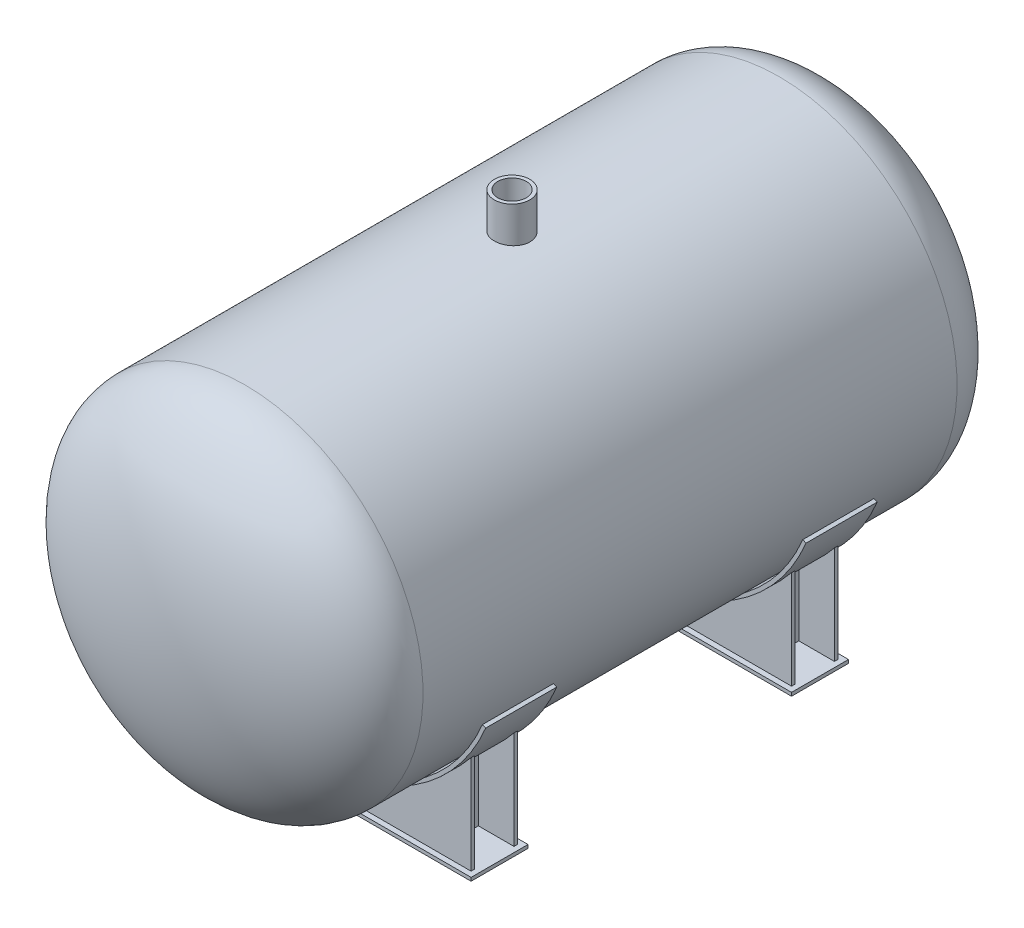
from build123d import *

# Parameters (mm, degrees)
REVOLVE_THIN1_OUTLINE_W   = 241.554
REVOLVE_THIN1_OUTLINE_H   = 38100
REVOLVE_THIN1_OUTLINE_H_2 = 6107.286275081
BOSS_EXTRUDE1_REACH       = 39840.343
BOSS_EXTRUDE1_END_RADIUS  = 12700
SKETCH2_R                 = 1270
SKETCH2_4_R               = 1016
CUT_EXTRUDE2_DEPTH        = 5334
EXTRUDE_THIN1_DEPTH       = 5080
BOSS_EXTRUDE2_DEPTH       = 241.554
BOSS_EXTRUDE3_DEPTH       = 241.554
SKETCH7_W                 = 2818.892
SKETCH7_H                 = 5080
BOSS_EXTRUDE4_DEPTH       = 241.554
SKETCH8_W                 = 2818.892
SKETCH8_H                 = 5080
BOSS_EXTRUDE5_DEPTH       = 241.554
SKETCH9_W                 = 21082
SKETCH9_H                 = 4064
BOSS_EXTRUDE6_DEPTH       = 241.554


# Read off the part's stored shape, not the designer's step: Revolve-Thin1
with BuildPart() as part:
    # Revolve-Thin1 outline → Revolve-Thin1 (revolve)
    with BuildSketch(Plane.XZ):
        with BuildLine():
            Line((12458.446, 19050), (12700, 19050))
            add(Edge.make_bspline(
                [(12700, 19050), (12700, 19672.212792945), (12458.446, 20282.591098568)],
                knots=[0, 0, 0, 0.209180689, 0.209180689, 0.209180689], degree=2, weights=[1, 0.960995831, 0.93237992]))
            Line((12458.446, 20282.591098568), (12458.446, 19050))
        make_face()
        with Locations((12579.223, 0)):
            Rectangle(REVOLVE_THIN1_OUTLINE_W, REVOLVE_THIN1_OUTLINE_H)
        with BuildLine():
            Line((12458.446, 19050), (12458.446, 20282.591098568))
            add(Edge.make_bspline(
                [(12458.446, 20282.591098568), (10950.298262556, 24093.501539344), (3477.674138965, 25157.286275081)],
                knots=[0.209180689, 0.209180689, 0.209180689, 1.277666813, 1.277666813, 1.277666813], degree=2, weights=[0.93237992, 0.786211057, 0.911084654]))
            Line((3477.674138965, 25157.286275081), (241.554, 25157.286275081))
            add(Edge.make_bspline(
                [(12458.446, 19050), (12458.446, 19128.360782016), (12455.30781716, 19206.148761458), (12443.010177021, 19360.625676184), (12433.850548794, 19437.31458027), (12409.727754911, 19589.633087136), (12394.764465027, 19665.262667241), (12359.219561467, 19815.496332604), (12338.63785601, 19890.100401109), (12303.668463951, 20001.258721755), (12291.328973355, 20038.186824626), (12275.061419578, 20084.193048318), (12271.765745268, 20093.386597076), (12265.090318364, 20111.758348049), (12261.709775455, 20120.938546931), (12251.462738317, 20148.402390778), (12244.484670145, 20166.626544561), (12208.877663579, 20257.331727468), (12178.101611862, 20328.567670849), (12112.3521677, 20468.60556913), (12077.37825829, 20537.407224248), (12003.551105812, 20672.760954559), (11964.697479581, 20739.312807561), (11883.378064491, 20870.321862974), (11840.911986397, 20934.778897662), (11752.593947216, 21061.729533345), (11706.741764435, 21124.223005782), (11647.430957785, 21201.182634036), (11635.468944632, 21216.516656789), (11617.378203209, 21239.432028849), (11611.323334963, 21247.056208713), (11599.164689255, 21262.276206563), (11593.059602946, 21269.873622091), (11562.448487739, 21307.74622806), (11537.661608642, 21337.708352381), (11462.448450122, 21426.633564336), (11411.170712082, 21484.636688989), (11306.536144088, 21598.298900389), (11253.179061975, 21653.957702844), (11144.546340289, 21763.112261769), (11089.27051472, 21816.607808544), (10976.93636394, 21921.589252253), (10919.877898914, 21973.074991556), (10804.094866676, 22074.168050718), (10745.370192594, 22123.775250087), (10626.355132409, 22221.224412617), (10566.064663398, 22269.066282304), (10444.005210705, 22363.083094686), (10382.236161848, 22409.257963899), (10257.295752829, 22500.026689561), (10194.12434082, 22544.620487557), (10098.365700913, 22610.382035198), (10066.27916639, 22632.114283338), (10025.967029197, 22659.049631982), (10017.893864481, 22664.425553185), (10001.737393508, 22675.147818592), (9977.483831272, 22691.189293281), (9953.174179215, 22707.106059376), (9872.019414462, 22759.889380327), (9806.703573515, 22801.244410074), (9675.335994034, 22882.318294742), (9609.284218408, 22922.037067193), (9476.486788138, 22999.931860227), (9409.741104136, 23038.107815533), (9275.592815724, 23112.999147049), (9208.190187806, 23149.71447099), (9005.045950731, 23257.778580128), (8868.369494178, 23327.048850864), (8592.742589938, 23460.533461851), (8453.79173004, 23524.746885603), (8173.791553847, 23648.508081818), (8032.741951625, 23708.055218557), (7748.686862383, 23822.800830588), (7605.681171803, 23877.99885329), (7317.830703978, 23984.305923063), (7172.98577869, 24035.414640977), (6881.553046037, 24133.756999859), (6734.96512915, 24180.990397317), (6550.69056582, 24237.720576115), (6513.783632916, 24248.950951481), (6458.346029802, 24265.62486178), (6439.851712267, 24271.154883904), (6402.858075872, 24282.151906939), (6384.356830404, 24287.619495276), (6291.828638155, 24314.804018607), (6217.735811731, 24336.060803799), (5995.252728402, 24398.40206063), (5846.65802749, 24438.058551428), (5548.952241356, 24513.764741552), (5399.841125558, 24549.814227314), (5101.1265842, 24618.474560953), (4951.52313544, 24651.085246784), (4651.844048874, 24713.00851781), (4501.768393293, 24742.320978845), (4201.161667618, 24797.764965422), (4050.630583824, 24823.896395276), (3749.126897358, 24873.07537637), (3598.154284115, 24896.122853788), (3295.778916103, 24939.213397445), (3144.376153224, 24959.256407039), (2841.149622768, 24996.401833108), (2689.325849063, 25013.504206773), (2385.264405117, 25044.818009387), (2233.026730389, 25059.029406989), (1928.142721918, 25084.597839999), (1775.496385091, 25095.954853872), (1469.798532017, 25115.838823364), (1316.747013935, 25124.36576617), (1010.240593239, 25138.602130283), (856.785689947, 25144.311546865), (549.472646377, 25152.913889099), (395.614506547, 25155.806817881), (241.554, 25157.286275081)],
                knots=[0, 0, 0, 0, 0.015625, 0.015625, 0.03125, 0.03125, 0.046875, 0.046875, 0.0625, 0.0625, 0.0703125, 0.0703125, 0.072265625, 0.072265625, 0.07421875, 0.07421875, 0.078125, 0.078125, 0.09375, 0.09375, 0.109375, 0.109375, 0.125, 0.125, 0.140625, 0.140625, 0.15625, 0.15625, 0.16015625, 0.16015625, 0.162109375, 0.162109375, 0.1640625, 0.1640625, 0.171875, 0.171875, 0.1875, 0.1875, 0.203125, 0.203125, 0.21875, 0.21875, 0.234375, 0.234375, 0.25, 0.25, 0.265625, 0.265625, 0.28125, 0.28125, 0.296875, 0.296875, 0.3046875, 0.3046875, 0.306640625, 0.306640625, 0.30859375, 0.3125, 0.3125, 0.328125, 0.328125, 0.34375, 0.34375, 0.359375, 0.359375, 0.375, 0.375, 0.40625, 0.40625, 0.4375, 0.4375, 0.46875, 0.46875, 0.5, 0.5, 0.53125, 0.53125, 0.5625, 0.5625, 0.5703125, 0.5703125, 0.57421875, 0.57421875, 0.578125, 0.578125, 0.59375, 0.59375, 0.625, 0.625, 0.65625, 0.65625, 0.6875, 0.6875, 0.71875, 0.71875, 0.75, 0.75, 0.78125, 0.78125, 0.8125, 0.8125, 0.84375, 0.84375, 0.875, 0.875, 0.90625, 0.90625, 0.9375, 0.9375, 0.96875, 0.96875, 1, 1, 1, 1], degree=3))
        make_face()
        with BuildLine():
            add(Edge.make_bspline(
                [(12458.446, -20282.591098568), (12700, -19672.212792945), (12700, -19050)],
                knots=[6.074004618, 6.074004618, 6.074004618, 6.283185307, 6.283185307, 6.283185307], degree=2, weights=[0.93237992, 0.960995831, 1]))
            Line((12700, -19050), (12458.446, -19050))
            Line((12458.446, -19050), (12458.446, -20282.591098568))
        make_face()
        with BuildLine():
            Line((241.554, 25157.286275081), (3477.674138965, 25157.286275081))
            add(Edge.make_bspline(
                [(3477.674138965, 25157.286275081), (1890.993518328, 25383.162298926), (241.554, 25398.851306833)],
                knots=[1.277666813, 1.277666813, 1.277666813, 1.549751414, 1.549751414, 1.549751414], degree=2, weights=[0.911084654, 0.942883086, 0.99225701]))
            Line((241.554, 25398.851306833), (241.554, 25157.286275081))
        make_face()
        with BuildLine():
            add(Edge.make_bspline(
                [(3477.674138965, -25157.286275081), (10950.298262556, -24093.501539344), (12458.446, -20282.591098568)],
                knots=[5.005518494, 5.005518494, 5.005518494, 6.074004618, 6.074004618, 6.074004618], degree=2, weights=[0.911084654, 0.786211057, 0.93237992]))
            Line((12458.446, -20282.591098568), (12458.446, -19050))
            add(Edge.make_bspline(
                [(241.554, -25157.286275081), (395.673425763, -25155.806252074), (549.538740628, -25152.912175305), (856.7640422, -25144.312016487), (1010.124027656, -25138.605927479), (1316.339490664, -25124.386308668), (1469.194968374, -25115.872779742), (1774.400184433, -25096.031428397), (1926.749924358, -25084.703614737), (2230.940355795, -25059.215280012), (2382.781050377, -25045.054776022), (2685.94793522, -25013.870700072), (2837.274130197, -24996.847154352), (3139.404296982, -24959.894041789), (3290.208275397, -24939.964511706), (3591.283858503, -24897.142945502), (3741.555472047, -24874.250958647), (4041.553512786, -24825.43318034), (4191.279951587, -24799.507453471), (4490.171863422, -24744.534387228), (4639.337351523, -24715.487131703), (4937.088218669, -24654.164481272), (5085.67361724, -24621.889195026), (5382.241283506, -24553.982373375), (5530.223576597, -24518.350979297), (5825.557463748, -24443.578533154), (5972.909091101, -24404.437666361), (6266.948660639, -24322.462716468), (6413.636646977, -24279.628879065), (6706.309381476, -24190.047886888), (6852.294189073, -24143.301062851), (7143.512911639, -24045.628914149), (7288.746908102, -23994.704042968), (7505.991353225, -23914.941462987), (7578.304989524, -23887.790905847), (7686.617351718, -23846.185332389), (7722.695117028, -23832.170147595), (7776.771377031, -23810.922623059), (7794.790165074, -23803.802614711), (7830.813728441, -23789.487011269), (7848.808693564, -23782.295314825), (8010.610849872, -23717.262614424), (8153.351566589, -23657.272071132), (8436.515445301, -23532.61982253), (8576.938900582, -23467.958708351), (8855.283194814, -23333.592315882), (8993.20445424, -23263.887885084), (9198.036622387, -23155.199910822), (9265.971999037, -23118.281240153), (9401.124385772, -23042.995990555), (9468.341419577, -23004.629459437), (9602.01839661, -22926.370438518), (9668.478369326, -22886.47800815), (9751.052692347, -22835.603396295), (9767.544373491, -22825.376800705), (9800.448400247, -22804.839044179), (9816.864057451, -22794.525859396), (9866.000753729, -22763.45191477), (9898.611530328, -22742.556780318), (9995.992695184, -22679.321551539), (10060.312151485, -22636.431915724), (10187.689322722, -22549.114985879), (10250.747081295, -22504.687745027), (10375.5338561, -22414.213952397), (10437.262926916, -22368.167467139), (10559.315892144, -22274.362037077), (10619.639855616, -22226.603176437), (10738.794899363, -22129.266109146), (10797.626068131, -22079.688010343), (10913.694200812, -21978.588988109), (10970.931279744, -21927.06820485), (11083.693274002, -21821.940059807), (11139.218341229, -21768.332883141), (11248.417757215, -21658.863097326), (11302.092310237, -21603.000737109), (11381.09278135, -21517.3653354), (11407.174157514, -21488.512955106), (11439.445989214, -21452.04545141), (11445.884992831, -21444.7305272), (11458.716899813, -21430.074569463), (11477.899683334, -21408.046904676), (11496.885839619, -21385.887117048), (11559.72964461, -21311.723229206), (11608.586959016, -21251.439481525), (11703.284570798, -21128.844714316), (11749.125084768, -21066.533840327), (11837.576441731, -20939.741928581), (11880.187570099, -20875.26108258), (11961.928624582, -20743.960211431), (12001.058932978, -20677.140443155), (12056.918267876, -20575.005066716), (12075.064941596, -20540.642040614), (12101.542852079, -20488.598850435), (12110.245107042, -20471.16799047), (12123.108556986, -20444.894076182), (12127.364716009, -20436.114832545), (12135.812964867, -20418.513294252), (12140.006580064, -20409.687715181), (12177.404271633, -20330.174985148), (12208.252727169, -20258.79625377), (12264.96478963, -20114.579634674), (12290.828556613, -20041.741793808), (12337.340276179, -19894.539347827), (12357.9884293, -19820.174801413), (12393.798340486, -19669.839740429), (12408.960355578, -19593.869301096), (12427.350840246, -19478.639574644), (12432.755192275, -19440.017208106), (12438.575411864, -19391.465493808), (12439.692992111, -19381.738448372), (12441.831015725, -19362.283705665), (12444.893311568, -19333.093300322), (12447.520916136, -19303.877994065), (12455.311302156, -19206.438171883), (12458.446, -19128.30887017), (12458.446, -19050)],
                knots=[0, 0, 0, 0, 0.03125, 0.03125, 0.0625, 0.0625, 0.09375, 0.09375, 0.125, 0.125, 0.15625, 0.15625, 0.1875, 0.1875, 0.21875, 0.21875, 0.25, 0.25, 0.28125, 0.28125, 0.3125, 0.3125, 0.34375, 0.34375, 0.375, 0.375, 0.40625, 0.40625, 0.4375, 0.4375, 0.46875, 0.46875, 0.5, 0.5, 0.515625, 0.515625, 0.5234375, 0.5234375, 0.52734375, 0.52734375, 0.53125, 0.53125, 0.5625, 0.5625, 0.59375, 0.59375, 0.625, 0.625, 0.640625, 0.640625, 0.65625, 0.65625, 0.671875, 0.671875, 0.67578125, 0.67578125, 0.6796875, 0.6796875, 0.6875, 0.6875, 0.703125, 0.703125, 0.71875, 0.71875, 0.734375, 0.734375, 0.75, 0.75, 0.765625, 0.765625, 0.78125, 0.78125, 0.796875, 0.796875, 0.8125, 0.8125, 0.8203125, 0.8203125, 0.822265625, 0.822265625, 0.82421875, 0.828125, 0.828125, 0.84375, 0.84375, 0.859375, 0.859375, 0.875, 0.875, 0.890625, 0.890625, 0.8984375, 0.8984375, 0.90234375, 0.90234375, 0.904296875, 0.904296875, 0.90625, 0.90625, 0.921875, 0.921875, 0.9375, 0.9375, 0.953125, 0.953125, 0.96875, 0.96875, 0.9765625, 0.9765625, 0.978515625, 0.978515625, 0.98046875, 0.984375, 0.984375, 1, 1, 1, 1], degree=3))
            Line((241.554, -25157.286275081), (3477.674138965, -25157.286275081))
        make_face()
        with BuildLine():
            Line((0, 25157.286275081), (241.554, 25157.286275081))
            Line((241.554, 25157.286275081), (241.554, 25398.851306833))
            add(Edge.make_bspline(
                [(241.554, 25398.851306833), (120.78792506, 25400), (0, 25400)],
                knots=[1.549751414, 1.549751414, 1.549751414, 1.570796327, 1.570796327, 1.570796327], degree=2, weights=[0.99225701, 0.996075932, 1]))
            Line((0, 25400), (0, 25157.286275081))
        make_face()
        with Locations((120.777, 22103.643137541)):
            Rectangle(REVOLVE_THIN1_OUTLINE_W, REVOLVE_THIN1_OUTLINE_H_2)
        with Locations((120.777, 0)):
            Rectangle(REVOLVE_THIN1_OUTLINE_W, REVOLVE_THIN1_OUTLINE_H)
        with BuildLine():
            add(Edge.make_bspline(
                [(241.554, -25398.851306833), (1890.993518328, -25383.162298926), (3477.674138965, -25157.286275081)],
                knots=[4.733433893, 4.733433893, 4.733433893, 5.005518494, 5.005518494, 5.005518494], degree=2, weights=[0.99225701, 0.942883086, 0.911084654]))
            Line((3477.674138965, -25157.286275081), (241.554, -25157.286275081))
            Line((241.554, -25157.286275081), (241.554, -25398.851306833))
        make_face()
        with Locations((120.777, -22103.643137541)):
            Rectangle(REVOLVE_THIN1_OUTLINE_W, REVOLVE_THIN1_OUTLINE_H_2)
        with BuildLine():
            Line((241.554, -25398.851306833), (241.554, -25157.286275081))
            Line((241.554, -25157.286275081), (0, -25157.286275081))
            Line((0, -25157.286275081), (0, -25400))
            add(Edge.make_bspline(
                [(0, -25400), (120.78792506, -25400), (241.554, -25398.851306833)],
                knots=[4.71238898, 4.71238898, 4.71238898, 4.733433893, 4.733433893, 4.733433893], degree=2, weights=[1, 0.996075932, 0.99225701]))
        make_face()
    revolve(axis=Axis((0, 0, 0), (0, 0, 1)))

    # Boss-Extrude1: up to this cylinder (the profile starts outside it)
    boss_extrude1_end = Plane(origin=(0, 0, 0), z_dir=(0, 0, -1)) * Cylinder(BOSS_EXTRUDE1_END_RADIUS, 105081.686, mode=Mode.PRIVATE)
    # Sketch2 → Boss-Extrude1 (add, up to the surface)
    with BuildSketch(Plane(origin=(0, 15240, 0), x_dir=(-1, 0, 0), z_dir=(0, -1, 0)), mode=Mode.PRIVATE) as boss_extrude1_sk1:
        Circle(SKETCH2_R)
    boss_extrude1_tool1 = extrude(boss_extrude1_sk1.sketch, amount=BOSS_EXTRUDE1_REACH, mode=Mode.PRIVATE) - boss_extrude1_end
    add(boss_extrude1_tool1.solids().sort_by_distance((0, 15240, 0))[0])

    # Sketch2<4> → Cut-Extrude2 (cut)
    with BuildSketch(Plane(origin=(0, 15240, 0), x_dir=(-1, 0, 0), z_dir=(0, -1, 0))):
        with Locations(Location((0, 0, 0), (0, 0, 90))):
            Circle(SKETCH2_4_R)
    extrude(amount=CUT_EXTRUDE2_DEPTH, mode=Mode.SUBTRACT)


with BuildPart() as body_2:
    # Sketch4 → Extrude-Thin1 (new body)
    with BuildSketch(Plane.XY.offset(8890)):
        with BuildLine():
            ThreePointArc((-11850.602763522, -4908.680386947), (0, -12827), (11850.602763522, -4908.680386947))
            Line((11850.602763522, -4908.680386947), (12085.26816478, -5005.881978768))
            ThreePointArc((12085.26816478, -5005.881978768), (0, -13081), (-12085.26816478, -5005.881978768))
            Line((-12085.26816478, -5005.881978768), (-11850.602763522, -4908.680386947))
        make_face()
    extrude(amount=EXTRUDE_THIN1_DEPTH)

    # Sketch5 → Boss-Extrude2 (add)
    with BuildSketch(Plane.XY.offset(9779)):
        with BuildLine():
            Line((-10160, -8239.354404321), (-10160, -15859.354404321))
            Line((-10160, -15859.354404321), (10160, -15859.354404321))
            Line((10160, -15859.354404321), (10160, -8239.354404321))
            ThreePointArc((10160, -8239.354404321), (0, -13081), (-10160, -8239.354404321))
        make_face()
    extrude(amount=BOSS_EXTRUDE2_DEPTH)

    # Sketch6 → Boss-Extrude3 (add)
    with BuildSketch(Plane.XY.offset(13081)):
        with BuildLine():
            Line((-10160, -8239.354404321), (-10160, -15859.354404321))
            Line((-10160, -15859.354404321), (10160, -15859.354404321))
            Line((10160, -15859.354404321), (10160, -8239.354404321))
            ThreePointArc((10160, -8239.354404321), (0, -13081), (-10160, -8239.354404321))
        make_face()
    extrude(amount=-BOSS_EXTRUDE3_DEPTH)

    # Sketch7 → Boss-Extrude4 (add)
    with BuildSketch(Plane(origin=(7620, 0, 0), x_dir=(0, 0, -1), z_dir=(1, 0, 0))):
        with Locations((-11430, -13319.354404321)):
            Rectangle(SKETCH7_W, SKETCH7_H)
    extrude(amount=-BOSS_EXTRUDE4_DEPTH)

    # Sketch8 → Boss-Extrude5 (add)
    with BuildSketch(Plane(origin=(-7620, 0, 0), x_dir=(0, 0, -1), z_dir=(1, 0, 0))):
        with Locations((-11430, -13319.354404321)):
            Rectangle(SKETCH8_W, SKETCH8_H)
    extrude(amount=-BOSS_EXTRUDE5_DEPTH)

    # Sketch9 → Boss-Extrude6 (add)
    with BuildSketch(Plane(origin=(0, -15494, 0), x_dir=(1, 0, 0), z_dir=(0, 1, 0))):
        with Locations((0, -11430)):
            Rectangle(SKETCH9_W, SKETCH9_H)
    extrude(amount=BOSS_EXTRUDE6_DEPTH)


with BuildPart() as body_3:
    # Mirror7: mirrored copy
    add(body_2.part.mirror(Plane.XY))


solid = Compound([part.part, body_2.part, body_3.part])
